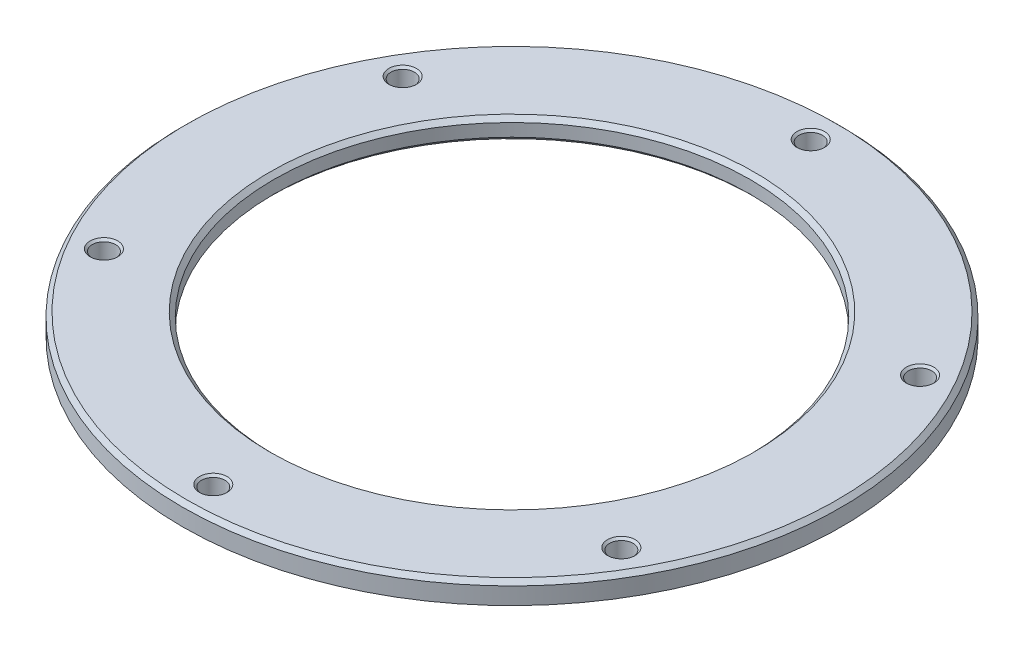
from build123d import *

# Parameters (mm, degrees)
SKETCH1_R                    = 77.5
SKETCH1_R_2                  = 56
BOSS_EXTRUDE1_DEPTH          = 5
SKETCH2_R                    = 2.75
CUT_EXTRUDE2_DEPTH           = 110.715541287
CHAMFER1_SIZE                = 0.5
CIRPATTERN1_COUNT            = 6
CHAMFER1_OF_CIRPATTERN1_SIZE = 0.5
CHAMFER2_SIZE                = 1


with BuildPart() as part:
    # Sketch1 → Boss-Extrude1 (new body)
    with BuildSketch(Plane(origin=(0, 0, 0), x_dir=(1, 0, 0), z_dir=(0, 1, 0))):
        Circle(SKETCH1_R)
        Circle(SKETCH1_R_2, mode=Mode.SUBTRACT)
    extrude(amount=BOSS_EXTRUDE1_DEPTH)

    # Sketch2 → Cut-Extrude2 (cut, through all)
    with BuildSketch(Plane(origin=(0, 5, 0), x_dir=(1, 0, 0), z_dir=(0, 1, 0))):
        with Locations((0, 70.25)):
            Circle(SKETCH2_R)
    cut_extrude2 = extrude(amount=-CUT_EXTRUDE2_DEPTH, mode=Mode.SUBTRACT)

    # Chamfer1
    chamfer1_edges = [part.edges().sort_by_distance(p)[0] for p in [
        (-2.75, 5, -70.25),
        (-2.75, 0, -70.25),
    ]]
    chamfer(chamfer1_edges, length=CHAMFER1_SIZE)

    # CirPattern1: Cut-Extrude2 ×6 about axis
    cirpattern1_axis = Axis((0, 5, 0), (0, -1, 0))
    for i in range(1, CIRPATTERN1_COUNT):
        add(cut_extrude2.rotate(cirpattern1_axis, i * 360 / CIRPATTERN1_COUNT), mode=Mode.SUBTRACT)

    # Chamfer1 of CirPattern1
    chamfer1_of_cirpattern1_edges = [part.edges().sort_by_distance(p)[0] for p in [
        (59.463284616, 5, -37.50656986),
        (59.463284616, 0, -37.50656986),
        (62.213284616, 5, 32.74343014),
        (62.213284616, 0, 32.74343014),
        (2.75, 5, 70.25),
        (2.75, 0, 70.25),
        (-59.463284616, 5, 37.50656986),
        (-59.463284616, 0, 37.50656986),
        (-62.213284616, 5, -32.74343014),
        (-62.213284616, 0, -32.74343014),
    ]]
    chamfer(chamfer1_of_cirpattern1_edges, length=CHAMFER1_OF_CIRPATTERN1_SIZE)

    # Chamfer2
    chamfer2_edges = [part.edges().sort_by_distance(p)[0] for p in [
        (-77.5, 5, 0),
        (-56, 0, 0),
        (-56, 5, 0),
    ]]
    chamfer(chamfer2_edges, length=CHAMFER2_SIZE)


solid = part.part
